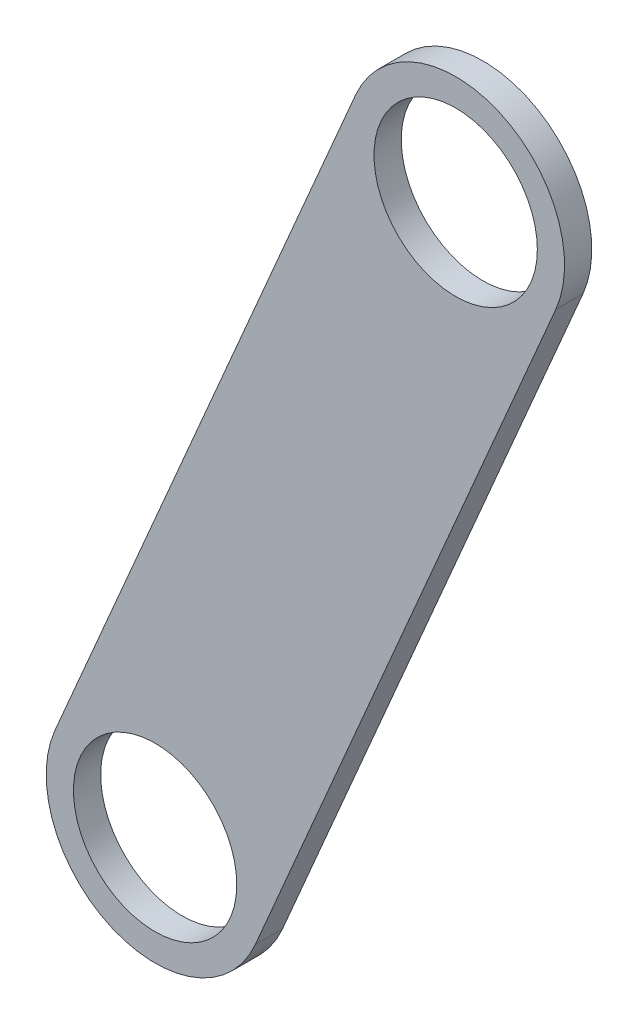
from build123d import *

# Parameters (mm, degrees)
ESQUISSE1_R               = 3
T_LE_DE_BASE_PLI_E1_DEPTH = 1


# Sheet-metal steps are written as plain solids
with BuildPart() as part:
    # Esquisse1 → Tôle de base pliée1 (new body)
    with BuildSketch(Plane.XY):
        with BuildLine():
            Line((35.440925163, -7.447621231), (24.398825897, -33.178381884))
            ThreePointArc((24.398825897, -33.178381884), (19.145560194, -35.276762083), (17.047179996, -30.02349638))
            Line((17.047179996, -30.02349638), (28.089279262, -4.292735726))
            ThreePointArc((28.089279262, -4.292735726), (33.342544964, -2.194355528), (35.440925163, -7.447621231))
        make_face()
        with Locations((31.765102212, -5.870178479)):
            Circle(ESQUISSE1_R, mode=Mode.SUBTRACT)
        with Locations((20.723002946, -31.600939132)):
            Circle(ESQUISSE1_R, mode=Mode.SUBTRACT)
    extrude(amount=T_LE_DE_BASE_PLI_E1_DEPTH)


solid = part.part
